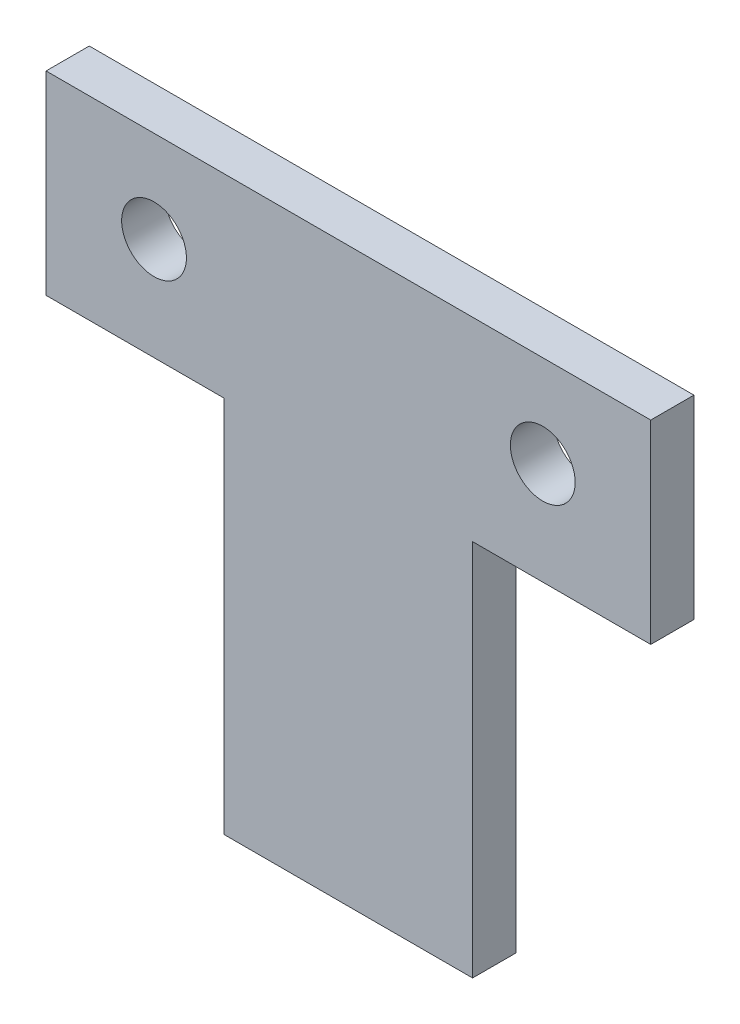
from build123d import *

# Parameters (mm, degrees)
SKETCH1_R           = 1.5
BOSS_EXTRUDE1_DEPTH = 2


with BuildPart() as part:
    # Sketch1 → Boss-Extrude1 (new body)
    with BuildSketch(Plane.XY):
        Polygon((0, 9), (0, 0), (8.25, 0), (8.25, -17.5), (14, -17.5), (19.75, -17.5), (19.75, 0), (28, 0), (28, 9), align=None)
        with Locations((5, 4.75)):
            Circle(SKETCH1_R, mode=Mode.SUBTRACT)
        with Locations((23, 4.75)):
            Circle(SKETCH1_R, mode=Mode.SUBTRACT)
    extrude(amount=BOSS_EXTRUDE1_DEPTH)


solid = part.part
